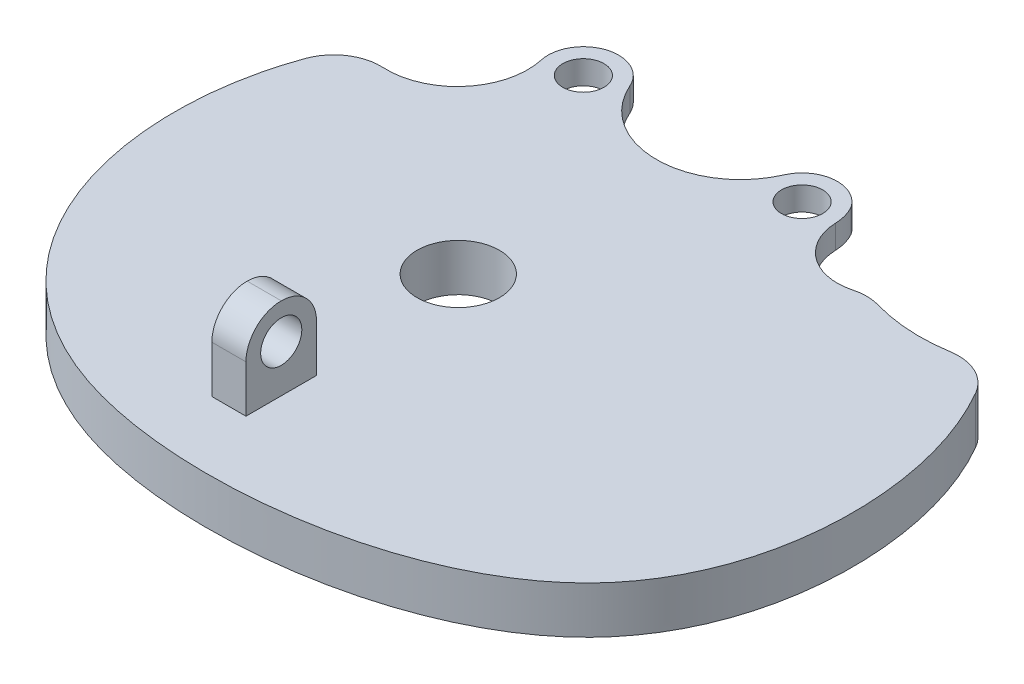
from build123d import *

# Parameters (mm, degrees)
BOSS_EXTRUDE1_DEPTH = 4
SKETCH53_R          = 3.5
CUT_EXTRUDE1_DEPTH  = 45.101345066
CUT_EXTRUDE2_REACH  = 46.101
SKETCH54_R          = 1.75
SKETCH55_R          = 6.5
CUT_EXTRUDE3_DEPTH  = 2
CUT_EXTRUDE4_REACH  = 46.101
FILLET1_START       = -1
FILLET1_DEPTH       = 6
FILLET1_2_DEPTH     = 3
SKETCH58_W          = 2.9
SKETCH58_H          = 6
BOSS_EXTRUDE3_DEPTH = 7
CUT_EXTRUDE5_REACH  = 44.995
SKETCH59_R          = 1.75
FILLET2_R           = 3


with BuildPart() as part:
    # Sketch1 → Boss-Extrude1 (new body)
    with BuildSketch(Plane.XZ):
        with BuildLine():
            add(Edge.make_bspline(
                [(-5, -26), (9.300931515, -30.45506709), (37.813922586, -21.505733488), (32.92542111, 23.636947818), (-15.261637243, 29.425031653), (-30.000918398, -3.863065553), (-16.359607573, -22.461222558), (-5, -26)],
                knots=[0, 0, 0, 0, 0.296836273, 0.417767996, 0.576795533, 0.764215109, 1, 1, 1, 1], degree=3))
        make_face()
    extrude(amount=-BOSS_EXTRUDE1_DEPTH)

    # Sketch53 → Cut-Extrude1 (cut, through all)
    with BuildSketch(Plane.XZ):
        with Locations(Location((0, 0, 0), (0, 0, 270))):
            Circle(SKETCH53_R)
    extrude(amount=-CUT_EXTRUDE1_DEPTH, mode=Mode.SUBTRACT)

    # Sketch54 → Cut-Extrude2 (cut, up to next)
    with BuildSketch(Plane(origin=(0, 4, 0), x_dir=(1, 0, 0), z_dir=(0, 1, 0)), mode=Mode.PRIVATE) as cut_extrude2_sk1:
        with Locations(Location((9.297601758, 19.938771315, 0), (0, 0, 270))):
            Circle(SKETCH54_R)
    cut_extrude2_tool1 = extrude(cut_extrude2_sk1.sketch, amount=-CUT_EXTRUDE2_REACH, mode=Mode.PRIVATE) & part.part
    # Sketch54 → Cut-Extrude2 (cut, up to next)
    with BuildSketch(Plane(origin=(0, 4, 0), x_dir=(1, 0, 0), z_dir=(0, 1, 0)), mode=Mode.PRIVATE) as cut_extrude2_sk2:
        with Locations(Location((-9.297601758, 19.938771315, 0), (0, 0, 270))):
            Circle(SKETCH54_R)
    cut_extrude2_tool2 = extrude(cut_extrude2_sk2.sketch, amount=-CUT_EXTRUDE2_REACH, mode=Mode.PRIVATE) & part.part
    add(cut_extrude2_tool1.solids().sort_by_distance((9.297602, 4, -19.938771))[0], mode=Mode.SUBTRACT)
    add(cut_extrude2_tool2.solids().sort_by_distance((-9.297602, 4, -19.938771))[0], mode=Mode.SUBTRACT)

    # Sketch55 → Cut-Extrude3 (cut)
    with BuildSketch(Plane.XZ):
        with Locations((-10.565456544, -22.657694676)):
            Circle(SKETCH55_R)
        with Locations((10.565456544, -22.657694676)):
            Circle(SKETCH55_R)
    extrude(amount=-CUT_EXTRUDE3_DEPTH, mode=Mode.SUBTRACT)

    # Sketch57 → Cut-Extrude4 (cut, up to next)
    with BuildSketch(Plane(origin=(0, 4, 0), x_dir=(1, 0, 0), z_dir=(0, 1, 0)), mode=Mode.PRIVATE) as cut_extrude4_sk1:
        with BuildLine():
            Line((-22.060581865, 22.49500396), (0, 42))
            Line((0, 42), (22.304364574, 44.876770574))
            ThreePointArc((22.304364574, 44.876770574), (39.121251811, 28.254649022), (18.917811778, 15.969551055))
            ThreePointArc((18.917811778, 15.969551055), (14.125407881, 16.318083551), (12.379781382, 20.794845567))
            ThreePointArc((12.379781382, 20.794845567), (12.075551875, 21.200220769), (11.785191385, 21.615642762))
            ThreePointArc((11.785191385, 21.615642762), (9.026021701, 22.926453405), (6.548427485, 21.139621352))
            ThreePointArc((6.548427485, 21.139621352), (0, 16.854115273), (-6.548427485, 21.139621352))
            ThreePointArc((-6.548427485, 21.139621352), (-10.225549177, 22.791649438), (-12.227166872, 19.29251421))
            ThreePointArc((-12.227166872, 19.29251421), (-19.944292188, 12.294927323), (-22.060581865, 22.49500396))
        make_face()
    cut_extrude4_tool1 = extrude(cut_extrude4_sk1.sketch, amount=-CUT_EXTRUDE4_REACH, mode=Mode.PRIVATE) & part.part
    add(cut_extrude4_tool1.solids().sort_by_distance((11.409927, 4, -28.912767))[0], mode=Mode.SUBTRACT)

    # Fillet1: read off the stored shape, not the designer's step
    # Fillet1 outline → Fillet1 (cut)
    with BuildSketch(Plane(origin=(0, 0, 0), x_dir=(1, 0, 0), z_dir=(0, 1, 0)).offset(FILLET1_START)):
        with BuildLine():
            ThreePointArc((-22.373774965, 9.362614286), (-20.824572083, 11.343383608), (-18.39938548, 12.008174263))
            ThreePointArc((-18.39938548, 12.008174263), (-19.695855613, 12.219920296), (-20.915171058, 12.708736245))
            Line((-20.915171058, 12.708736245), (-24, 14.357981617))
            Line((-24, 14.357981617), (-24, 8.283982068))
            Line((-24, 8.283982068), (-22.652447274, 8.584709442))
            Line((-22.652447274, 8.584709442), (-22.373774965, 9.362614286))
        make_face()
        with BuildLine():
            ThreePointArc((11.785191385, 21.615642762), (12.153103234, 20.731309712), (12.300234414, 19.784865583))
            ThreePointArc((12.300234414, 19.784865583), (12.311494547, 20.292101313), (12.379781382, 20.794845567))
            ThreePointArc((12.379781382, 20.794845567), (12.075551875, 21.200220769), (11.785191385, 21.615642762))
        make_face()
        with BuildLine():
            ThreePointArc((18.917811778, 15.969551055), (18.452844275, 15.754255547), (17.966416089, 15.593213461))
            ThreePointArc((17.966416089, 15.593213461), (19.036251843, 15.730376095), (20.103841604, 15.57670687))
            ThreePointArc((20.103841604, 15.57670687), (19.506734762, 15.760775084), (18.917811778, 15.969551055))
        make_face()
        with BuildLine():
            Line((32, 12.179159592), (32, 16.806756394))
            Line((32, 16.806756394), (29.077324798, 15.80715373))
            ThreePointArc((29.077324798, 15.80715373), (27.874565267, 15.45121689), (26.646272996, 15.197013))
            ThreePointArc((26.646272996, 15.197013), (29.011043988, 14.861530827), (30.763059215, 13.238221621))
            Line((30.763059215, 13.238221621), (31.24661263, 12.394327306))
            Line((31.24661263, 12.394327306), (32, 12.179159592))
        make_face()
    extrude(amount=FILLET1_DEPTH, mode=Mode.SUBTRACT)

    # Fillet1 2 outline → Fillet1 2 (cut)
    with BuildSketch(Plane(origin=(0, 0, 0), x_dir=(1, 0, 0), z_dir=(0, 1, 0)).offset(FILLET1_START)):
        with BuildLine():
            ThreePointArc((-12.305007931, 16.394791118), (-12.673993332, 15.410218555), (-13.209186576, 14.505176264))
            ThreePointArc((-13.209186576, 14.505176264), (-11.887647204, 15.67895056), (-10.189275554, 16.168589355))
            ThreePointArc((-10.189275554, 16.168589355), (-11.256460538, 16.194528773), (-12.305007931, 16.394791118))
        make_face()
        with BuildLine():
            ThreePointArc((-5.156588961, 19.052954537), (-5.970866268, 18.059897356), (-6.964491378, 17.246313163))
            ThreePointArc((-6.964491378, 17.246313163), (-5.042351245, 17.905425005), (-3.044381494, 17.535063044))
            ThreePointArc((-3.044381494, 17.535063044), (-4.170129225, 18.197096349), (-5.156588961, 19.052954537))
        make_face()
        with BuildLine():
            ThreePointArc((5.156588961, 19.052954537), (4.170129225, 18.197096349), (3.044381494, 17.535063044))
            ThreePointArc((3.044381494, 17.535063044), (5.042351245, 17.905425005), (6.964491378, 17.246313163))
            ThreePointArc((6.964491378, 17.246313163), (5.970866268, 18.059897356), (5.156588961, 19.052954537))
        make_face()
        with BuildLine():
            ThreePointArc((11.981206879, 16.313748665), (13.377106137, 16.375222999), (14.708985574, 15.952835737))
            ThreePointArc((14.708985574, 15.952835737), (14.072149248, 16.358002038), (13.51199171, 16.863910894))
            ThreePointArc((13.51199171, 16.863910894), (12.763877186, 16.540755353), (11.981206879, 16.313748665))
        make_face()
    extrude(amount=FILLET1_2_DEPTH, mode=Mode.SUBTRACT)

    # Sketch58 → Boss-Extrude3 (add)
    with BuildSketch(Plane(origin=(0, 4, 0), x_dir=(1, 0, 0), z_dir=(0, 1, 0))):
        with Locations((0, -16.5)):
            Rectangle(SKETCH58_W, SKETCH58_H)
    extrude(amount=BOSS_EXTRUDE3_DEPTH)

    # Sketch59 → Cut-Extrude5 (cut, up to next)
    with BuildSketch(Plane(origin=(1.45, 0, 0), x_dir=(0, 0, -1), z_dir=(1, 0, 0)), mode=Mode.PRIVATE) as cut_extrude5_sk1:
        with Locations((-16.5, 8)):
            Circle(SKETCH59_R)
    cut_extrude5_tool1 = extrude(cut_extrude5_sk1.sketch, amount=-CUT_EXTRUDE5_REACH, mode=Mode.PRIVATE) & part.part
    add(cut_extrude5_tool1.solids().sort_by_distance((1.45, 8, 16.5))[0], mode=Mode.SUBTRACT)

    # Fillet2
    fillet2_edges = [part.edges().sort_by_distance(p)[0] for p in [
        (0, 11, 13.5),
        (0, 11, 19.5),
    ]]
    fillet(fillet2_edges, radius=FILLET2_R - 0.0001)  # a hair under: the kernel refuses the full size


solid = part.part
